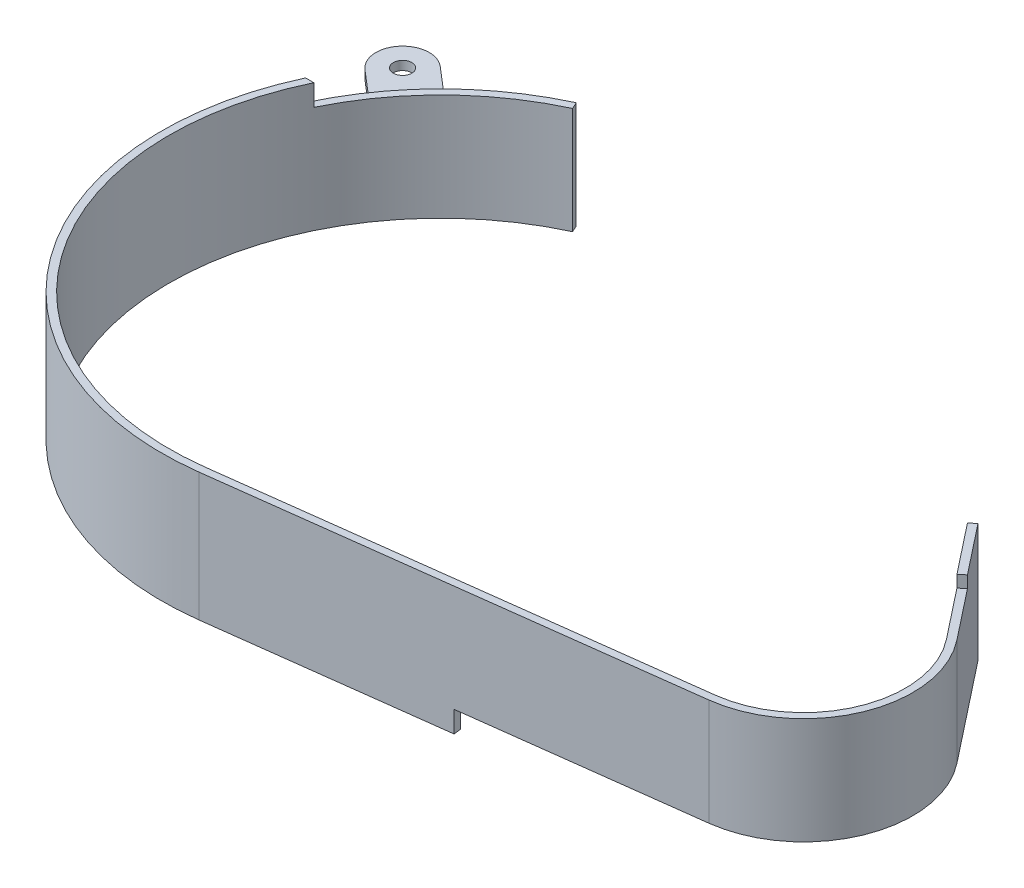
from build123d import *
from build123d.topology import SkipClean

# Parameters (mm, degrees)
BASE_FLANGE1_DEPTH  = 38.1
CUT_EXTRUDE1_DEPTH  = 7.62
SKETCH9_R           = 3.3
BOSS_EXTRUDE1_DEPTH = 3.175
BOSS_EXTRUDE2_DEPTH = 7.62
BOSS_EXTRUDE4_DEPTH = 4.26074332


# Sheet-metal steps are written as plain solids
with BuildPart() as part:
    # Sketch1 → Base-Flange1 (new body)
    with BuildSketch(Plane(origin=(0, 0, 0), x_dir=(1, 0, 0), z_dir=(0, 1, 0))):
        with BuildLine():
            Line((-657.047015903, -180.398251424), (-495.540915967, -159.83264605))
            ThreePointArc((-495.540915967, -159.83264605), (-466.529161595, -137.56639807), (-471.621526187, -101.351269827))
            Line((-471.621526187, -101.351269827), (-499.562056453, -65.912999952))
            Line((-499.562056453, -65.912999952), (-497.56764915, -64.134999952))
            Line((-497.56764915, -64.134999952), (-469.527179345, -99.700027778))
            ThreePointArc((-469.527179345, -99.700027778), (-464.060656724, -138.576037958), (-495.204030033, -162.478283377))
            Line((-495.204030033, -162.478283377), (-656.710129969, -183.043888751))
            ThreePointArc((-656.710129969, -183.043888751), (-764.987734735, -111.822063922), (-711.2, 6.090902363))
            Line((-711.2, 6.090902363), (-710.077660148, 3.671554877))
            ThreePointArc((-710.077660148, 3.671554877), (-762.424972114, -111.083730158), (-657.047015903, -180.398251424))
        make_face()
    extrude(amount=-BASE_FLANGE1_DEPTH)

    # Sketch7 → Cut-Extrude1 (cut)
    with BuildSketch(Plane(origin=(-711.2, 0, -6.090902363), x_dir=(1, 0, 0), z_dir=(0, 1, 0))):
        with BuildLine():
            Line((1.122339852, -2.419347486), (0, 0))
            ThreePointArc((0, 0), (-28.443609249, -19.854342865), (-48.352212426, -48.26))
            Line((-48.352212426, -48.26), (-45.400744677, -48.26))
            ThreePointArc((-45.400744677, -48.26), (-26.116771828, -21.302890058), (1.122339852, -2.419347486))
        make_face()
    extrude(amount=-CUT_EXTRUDE1_DEPTH, mode=Mode.SUBTRACT)

    # Sketch9 → Boss-Extrude1 (add)
    with BuildSketch(Plane(origin=(0, -11.93175668, 0), x_dir=(1, 0, 0), z_dir=(0, 1, 0))):
        with BuildLine():
            ThreePointArc((-751.074016673, -2.593523568), (-764.50540437, -3.617766971), (-763.481160967, -17.049154667))
            Line((-763.481160967, -17.049154667), (-751.193944793, -27.595167013))
            ThreePointArc((-751.193944793, -27.595167013), (-745.401952839, -20.024035331), (-738.912633033, -13.041347154))
            Line((-738.912633033, -13.041347154), (-751.074016673, -2.593523568))
        make_face()
        with Locations(Location((-757.27758882, -9.821339117, 0), (0, 0, 270))):
            Circle(SKETCH9_R, mode=Mode.SUBTRACT)
    extrude(amount=-BOSS_EXTRUDE1_DEPTH)

    # Sketch10 → Boss-Extrude2 (add)
    with SkipClean():  # the faces are left unmerged after this step: merging them gives an invalid solid
        with BuildSketch(Plane.XZ.offset(38.1)):
            with BuildLine():
                Line((-710.077660148, -3.671554877), (-711.2, -6.090902363))
                ThreePointArc((-711.2, -6.090902363), (-764.987734735, 111.822063922), (-656.710129969, 183.043888751))
                Line((-656.710129969, 183.043888751), (-575.957080001, 172.761086064))
                Line((-575.957080001, 172.761086064), (-576.293965935, 170.115448737))
                Line((-576.293965935, 170.115448737), (-657.047015903, 180.398251424))
                ThreePointArc((-657.047015903, 180.398251424), (-762.424972114, 111.083730158), (-710.077660148, -3.671554877))
            make_face()
        extrude(amount=BOSS_EXTRUDE2_DEPTH)

    # Sketch12 → Boss-Extrude4 (add)
    with SkipClean():  # the faces are left unmerged after this step: merging them gives an invalid solid
        with BuildSketch(Plane(origin=(0, 0, 0), x_dir=(1, 0, 0), z_dir=(0, 1, 0))):
            Polygon((-497.56764915, -64.134999952), (-499.562056453, -65.912999952), (-485.59179132, -83.632134889), (-483.547414248, -81.917513865), align=None)
        extrude(amount=BOSS_EXTRUDE4_DEPTH)


solid = part.part
